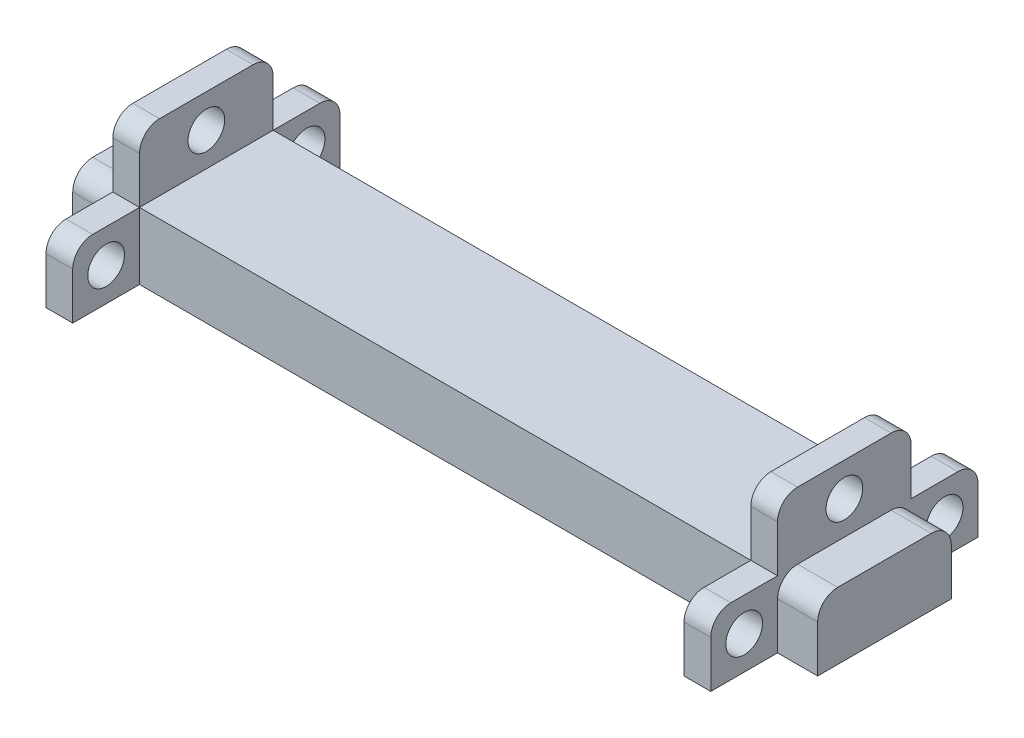
from build123d import *

# Parameters (mm, degrees)
SKETCH_2_W             = 20
SKETCH_2_H             = 10
EXTRUDE_1_DEPTH        = 55.75
SKETCH_3_W             = 20
SKETCH_3_H             = 10
SKETCH_3_R             = 2.75
SKETCH_3_W_2           = 10
EXTRUDE_2_DEPTH        = 4
FILLET_1_R             = 3
FILLET_1_OF_MIRROR_1_R = 3
FILLET_2_R             = 3


with BuildPart() as part:
    # 草图2 → 凸台-拉伸1 (new, symmetric)
    with BuildSketch(Plane(origin=(0, 0, 0), x_dir=(0, 0, -1), z_dir=(1, 0, 0))):
        Rectangle(SKETCH_2_W, SKETCH_2_H)
    extrude(amount=EXTRUDE_1_DEPTH, both=True)

    # 草图3 → 凸台-拉伸2 (add)
    # profile 1 of 3: a face of its own
    with BuildSketch(Plane(origin=(49.75, 0, 0), x_dir=(0, 0, -1), z_dir=(1, 0, 0))):
        with Locations((0, 10)):
            Rectangle(SKETCH_3_W, SKETCH_3_H)
        with Locations((0, 10)):
            Circle(SKETCH_3_R, mode=Mode.SUBTRACT)
    # profile 2 of 3: a face of its own
    with BuildSketch(Plane(origin=(49.75, 0, 0), x_dir=(0, 0, -1), z_dir=(1, 0, 0))):
        with Locations((15, 0)):
            Rectangle(SKETCH_3_W_2, SKETCH_3_H)
        with Locations((15, 0)):
            Circle(SKETCH_3_R, mode=Mode.SUBTRACT)
    # profile 3 of 3: a face of its own
    with BuildSketch(Plane(origin=(49.75, 0, 0), x_dir=(0, 0, -1), z_dir=(1, 0, 0))):
        with Locations((-15, 0)):
            Rectangle(SKETCH_3_W_2, SKETCH_3_H)
        with Locations((-15, 0)):
            Circle(SKETCH_3_R, mode=Mode.SUBTRACT)
    extrude_2 = extrude(amount=-EXTRUDE_2_DEPTH)

    # 圆角1
    fillet_1_edges = [part.edges().sort_by_distance(p)[0] for p in [
        (47.75, 15, 10),
        (47.75, 15, -10),
        (47.75, 5, -20),
        (47.75, 5, 20),
    ]]
    fillet(fillet_1_edges, radius=FILLET_1_R)

    # 镜向1: 凸台-拉伸2 across plane
    add(extrude_2.mirror(Plane(origin=(0, 0, 0), x_dir=(0, 0, 1), z_dir=(1, 0, 0))))

    # 圆角1 of 镜向1
    fillet_1_of_mirror_1_edges = [part.edges().sort_by_distance(p)[0] for p in [
        (-47.75, 15, 10),
        (-47.75, 15, -10),
        (-47.75, 5, -20),
        (-47.75, 5, 20),
    ]]
    fillet(fillet_1_of_mirror_1_edges, radius=FILLET_1_OF_MIRROR_1_R)

    # 圆角2
    # the kernel refuses this fillet: 3 mm, written as the material it takes off along each edge
    with BuildSketch(Plane(origin=(63.25, 5, 10), x_dir=(0, -1, 0), z_dir=(-1, 0, 0)), Plane(origin=(49.75, 5, -10), x_dir=(0, -1, 0), z_dir=(1, 0, 0)), Plane(origin=(-49.75, 5, 10), x_dir=(0, -1, 0), z_dir=(-1, 0, 0)), Plane(origin=(-63.25, 5, -10), x_dir=(0, -1, 0), z_dir=(1, 0, 0))) as fillet_2_piece_1:
        with BuildLine():
            CenterArc((FILLET_2_R, -FILLET_2_R), FILLET_2_R, 90, 90)
            Line((0, -FILLET_2_R), (0, 0))
            Line((0, 0), (FILLET_2_R, 0))
        make_face()
    extrude(amount=13.5, mode=Mode.SUBTRACT)


solid = part.part
